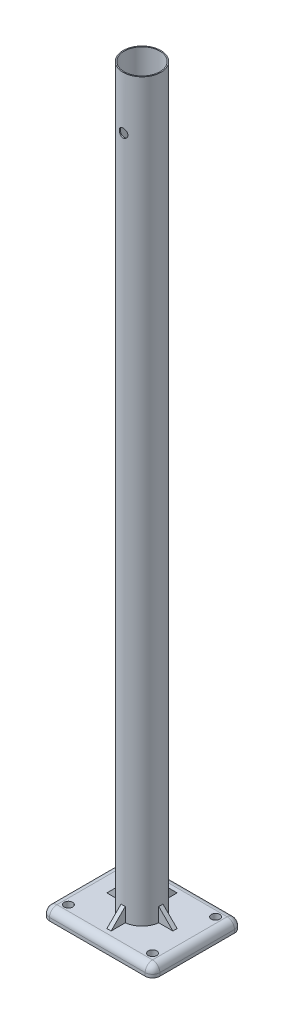
from build123d import *

# Parameters (mm, degrees)
SKETCH1_W               = 105
SKETCH1_H               = 85
SKETCH1_R               = 4
BOSS_EXTRUDE1_DEPTH     = 10
FILLET1_R               = 7
FILLET2_R               = 7
SKETCH17_R              = 18
SKETCH17_R_2            = 17
BOSS_EXTRUDE2_DEPTH     = 700
RIB2_REACH              = 715.206
SKETCH18_WALL_W         = 1447.913707502
SKETCH18_WALL_H         = 4
CIRPATTERN1_COUNT       = 4
CUT_EXTRUDE1_REACH      = 716.504
CUT_EXTRUDE1_END_RADIUS = 17
SKETCH19_R              = 4.1


with BuildPart() as part:
    # Sketch1 → Boss-Extrude1 (new body)
    with BuildSketch(Plane(origin=(0, 0, 0), x_dir=(1, 0, 0), z_dir=(0, 1, 0))):
        Rectangle(SKETCH1_W, SKETCH1_H)
        with Locations(Location((-40, -30, 0), (0, 0, 270))):
            Circle(SKETCH1_R, mode=Mode.SUBTRACT)
        with Locations(Location((40, 30, 0), (0, 0, 270))):
            Circle(SKETCH1_R, mode=Mode.SUBTRACT)
        with Locations(Location((40, -30, 0), (0, 0, 270))):
            Circle(SKETCH1_R, mode=Mode.SUBTRACT)
        with Locations(Location((-40, 30, 0), (0, 0, 270))):
            Circle(SKETCH1_R, mode=Mode.SUBTRACT)
    extrude(amount=BOSS_EXTRUDE1_DEPTH)

    # Fillet1
    fillet1_edges = [part.edges().sort_by_distance(p)[0] for p in [
        (52.5, 10, 0),
        (-52.5, 10, 0),
        (52.5, 5, 42.5),
        (-52.5, 5, 42.5),
    ]]
    fillet(fillet1_edges, radius=FILLET1_R)

    # Fillet2
    # the kernel refuses this fillet: 7 mm, written as the material it takes off along each edge
    with BuildSketch(Plane(origin=(45.5, 3, 35.5), x_dir=(0, 1, 0), z_dir=(0, 0, 1))) as fillet2_piece_1_section:
        Polygon((0, 0), (FILLET2_R, 0), (FILLET2_R, -FILLET2_R), (0, -FILLET2_R), align=None)
    fillet2_piece_1 = extrude(amount=FILLET2_R, mode=Mode.PRIVATE)
    fillet2_piece_1 = fillet2_piece_1 - Plane(origin=(45.5, 3, 35.5), x_dir=(-0.7071067811865475, -0.7071067811865475, 0), z_dir=(0, 0, 1)) * Sphere(FILLET2_R, mode=Mode.PRIVATE)
    add(fillet2_piece_1, mode=Mode.SUBTRACT)
    with BuildSketch(Plane(origin=(-45.5, 3, 35.5), x_dir=(0, 1, 0), z_dir=(0, 0, 1))) as fillet2_piece_2_section:
        Polygon((0, 0), (FILLET2_R, 0), (FILLET2_R, FILLET2_R), (0, FILLET2_R), align=None)
    fillet2_piece_2 = extrude(amount=FILLET2_R, mode=Mode.PRIVATE)
    fillet2_piece_2 = fillet2_piece_2 - Plane(origin=(-45.5, 3, 35.5), x_dir=(0.7071067811865475, -0.7071067811865475, 0), z_dir=(0, 0, 1)) * Sphere(FILLET2_R, mode=Mode.PRIVATE)
    add(fillet2_piece_2, mode=Mode.SUBTRACT)
    with BuildSketch(Plane(origin=(45.5, 10, 42.5), x_dir=(0, -1, 0), z_dir=(-1, 0, 0))) as fillet2_piece_3:
        with BuildLine():
            CenterArc((FILLET2_R, -FILLET2_R), FILLET2_R, 90, 90)
            Line((0, -FILLET2_R), (0, 0))
            Line((0, 0), (FILLET2_R, 0))
        make_face()
    extrude(amount=91, mode=Mode.SUBTRACT)
    with BuildSketch(Plane(origin=(-45.5, 10, -42.5), x_dir=(0, 0, 1), z_dir=(1, 0, 0))) as fillet2_piece_4:
        with BuildLine():
            CenterArc((FILLET2_R, FILLET2_R), FILLET2_R, 180, 90)
            Line((0, FILLET2_R), (0, 0))
            Line((0, 0), (FILLET2_R, 0))
        make_face()
    extrude(amount=91, mode=Mode.SUBTRACT)
    with BuildSketch(Plane(origin=(-52.5, -17.5, -42.5), x_dir=(0, 0, 1), z_dir=(0, 1, 0))) as fillet2_piece_5:
        with BuildLine():
            CenterArc((FILLET2_R, FILLET2_R), FILLET2_R, 180, 90)
            Line((0, FILLET2_R), (0, 0))
            Line((0, 0), (FILLET2_R, 0))
        make_face()
    extrude(amount=20.5, mode=Mode.SUBTRACT)
    with BuildSketch(Plane(origin=(52.5, -17.5, -42.5), x_dir=(0, 0, 1), z_dir=(0, 1, 0))) as fillet2_piece_6:
        with BuildLine():
            CenterArc((FILLET2_R, -FILLET2_R), FILLET2_R, 90, 90)
            Line((0, -FILLET2_R), (0, 0))
            Line((0, 0), (FILLET2_R, 0))
        make_face()
    extrude(amount=20.5, mode=Mode.SUBTRACT)
    with BuildSketch(Plane(origin=(-45.5, 3, -42.5), x_dir=(-1, 0, 0), z_dir=(0, -1, 0))) as fillet2_piece_7:
        with BuildLine():
            CenterArc((7 - FILLET2_R, -FILLET2_R), FILLET2_R, 0, 90)
            Line((7, -FILLET2_R), (7, 0))
            Line((7, 0), (7 - FILLET2_R, 0))
        make_face()
    revolve(axis=Axis((-45.5, 3, -42.5), (0, 0, -1)), revolution_arc=90, mode=Mode.SUBTRACT)
    with BuildSketch(Plane(origin=(45.5, 3, -42.5), x_dir=(1, 0, 0), z_dir=(0, -1, 0))) as fillet2_piece_8:
        with BuildLine():
            CenterArc((7 - FILLET2_R, FILLET2_R), FILLET2_R, 270, 90)
            Line((7, FILLET2_R), (7, 0))
            Line((7, 0), (7 - FILLET2_R, 0))
        make_face()
    revolve(axis=Axis((45.5, 3, -42.5), (0, 0, 1)), revolution_arc=90, mode=Mode.SUBTRACT)

    # Sketch17 → Boss-Extrude2 (add)
    with BuildSketch(Plane(origin=(0, 10, 0), x_dir=(1, 0, 0), z_dir=(0, 1, 0))):
        with Locations(Location((0, 0, 0), (0, 0, 270))):
            Circle(SKETCH17_R)
        with Locations(Location((0, 0, 0), (0, 0, 270))):
            Circle(SKETCH17_R_2, mode=Mode.SUBTRACT)
    extrude(amount=BOSS_EXTRUDE2_DEPTH)

    # Sketch18 wall → Rib2 (add, up to next)
    with BuildSketch(Plane(origin=(-24.522935069, 16.901577145, 0), x_dir=(-0.707106781187, -0.707106781187, 0), z_dir=(0.707106781187, -0.707106781187, 0)), mode=Mode.PRIVATE) as rib2_sk1:
        Rectangle(SKETCH18_WALL_W, SKETCH18_WALL_H)
    rib2_tool1 = extrude(rib2_sk1.sketch, amount=RIB2_REACH, mode=Mode.PRIVATE) - part.part
    rib2 = rib2_tool1.solids().sort_by_distance((-24.522935069, 16.901577145, 0))[0]
    add(rib2)

    # CirPattern1: Rib2 ×4 about axis
    cirpattern1_axis = Axis((0, 0, 0), (0, 1, 0))
    for i in range(1, CIRPATTERN1_COUNT):
        add(rib2.rotate(cirpattern1_axis, i * 360 / CIRPATTERN1_COUNT))

    # Cut-Extrude1: up to this cylinder (the profile starts outside it)
    cut_extrude1_end = Plane(origin=(0, 660, 0), z_dir=(0, -1, 0)) * Cylinder(CUT_EXTRUDE1_END_RADIUS, 1468.008, mode=Mode.PRIVATE)
    # Sketch19 → Cut-Extrude1 (cut, up to the surface)
    with BuildSketch(Plane.XY.offset(18), mode=Mode.PRIVATE) as cut_extrude1_sk1:
        with Locations((0, 660)):
            Circle(SKETCH19_R)
    cut_extrude1_tool1 = extrude(cut_extrude1_sk1.sketch, amount=-CUT_EXTRUDE1_REACH, mode=Mode.PRIVATE) - cut_extrude1_end
    add(cut_extrude1_tool1.solids().sort_by_distance((0, 660, 18))[0], mode=Mode.SUBTRACT)


solid = part.part
